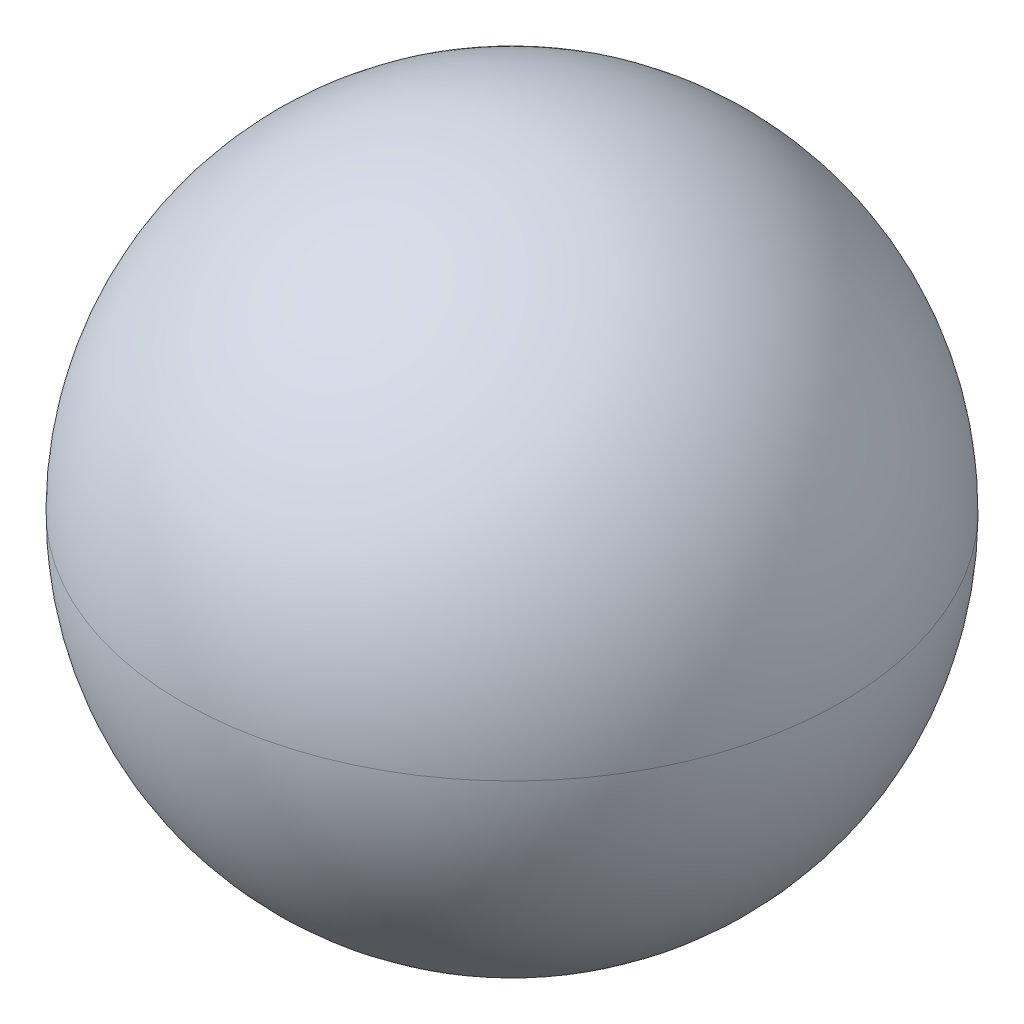
from build123d import *

# Parameters (mm, degrees)
CROQUIS1_R              = 11.7
SALIENTE_EXTRUIR1_DEPTH = 23.4
REDONDEO1_R             = 11.7
CROQUIS2_R              = 3
CORTAR_EXTRUIR1_DEPTH   = 8


with BuildPart() as part:
    # Croquis1 → Saliente-Extruir1 (new body)
    with BuildSketch(Plane(origin=(0, 0, 0), x_dir=(1, 0, 0), z_dir=(0, 1, 0))):
        with Locations(Location((0, 0, 0), (0, 0, 270))):
            Circle(CROQUIS1_R)
    extrude(amount=SALIENTE_EXTRUIR1_DEPTH)

    # Redondeo1
    redondeo1_edges = [part.edges().sort_by_distance(p)[0] for p in [
        (0, 0, -11.7),
        (0, 23.4, -11.7),
    ]]
    fillet(redondeo1_edges, radius=REDONDEO1_R - 0.0001)  # a hair under: the kernel refuses the full size

    # Croquis2 → Cortar-Extruir1 (cut)
    with BuildSketch(Plane(origin=(0, 0, 0), x_dir=(1, 0, 0), z_dir=(0, 1, 0))):
        with Locations(Location((0, 0, 0), (0, 0, 270))):
            Circle(CROQUIS2_R)
    extrude(amount=CORTAR_EXTRUIR1_DEPTH, mode=Mode.SUBTRACT)


solid = part.part
